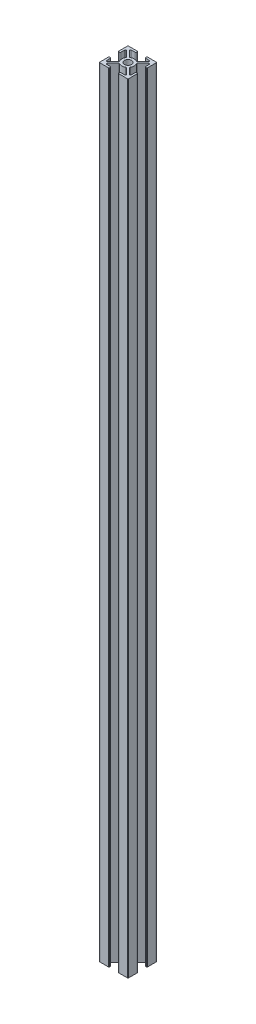
from build123d import *

# Parameters (mm, degrees)
SKETCH1_R           = 2.5
BOSS_EXTRUDE1_DEPTH = 540


with BuildPart() as part:
    # Sketch1 → Boss-Extrude1 (new body)
    with BuildSketch(Plane(origin=(0, 0, 0), x_dir=(1, 0, 0), z_dir=(0, 1, 0))):
        with BuildLine():
            Line((-6.247396549, 8.6), (-3.6, 8.6))
            ThreePointArc((-3.6, 8.6), (-3.317157288, 8.717157288), (-3.2, 9))
            Line((-3.2, 9), (-3.2, 9.6))
            ThreePointArc((-3.2, 9.6), (-3.317157288, 9.882842712), (-3.6, 10))
            Line((-3.6, 10), (-9.5, 10))
            ThreePointArc((-9.5, 10), (-9.853553391, 9.853553391), (-10, 9.5))
            Line((-10, 9.5), (-10, 3.6))
            ThreePointArc((-10, 3.6), (-9.882842712, 3.317157288), (-9.6, 3.2))
            Line((-9.6, 3.2), (-9, 3.2))
            ThreePointArc((-9, 3.2), (-8.717157288, 3.317157288), (-8.6, 3.6))
            Line((-8.6, 3.6), (-8.6, 6.402943725))
            ThreePointArc((-8.6, 6.402943725), (-8.291341716, 6.864883491), (-7.746446609, 6.756497116))
            Line((-7.746446609, 6.756497116), (-3.744782433, 2.75483294))
            ThreePointArc((-3.744782433, 2.75483294), (-3.602407081, 2.46495593), (-3.666932053, 2.148513281))
            ThreePointArc((-3.666932053, 2.148513281), (-4.25, 0), (-3.666932053, -2.148513281))
            ThreePointArc((-3.666932053, -2.148513281), (-3.602407081, -2.46495593), (-3.744782433, -2.75483294))
            Line((-3.744782433, -2.75483294), (-7.636458146, -6.646508652))
            ThreePointArc((-7.636458146, -6.646508652), (-8.251568164, -6.768861642), (-8.6, -6.247396549))
            Line((-8.6, -6.247396549), (-8.6, -3.6))
            ThreePointArc((-8.6, -3.6), (-8.717157288, -3.317157288), (-9, -3.2))
            Line((-9, -3.2), (-9.6, -3.2))
            ThreePointArc((-9.6, -3.2), (-9.882842712, -3.317157288), (-10, -3.6))
            Line((-10, -3.6), (-10, -9.5))
            ThreePointArc((-10, -9.5), (-9.853553391, -9.853553391), (-9.5, -10))
            Line((-9.5, -10), (-3.6, -10))
            ThreePointArc((-3.6, -10), (-3.317157288, -9.882842712), (-3.2, -9.6))
            Line((-3.2, -9.6), (-3.2, -9))
            ThreePointArc((-3.2, -9), (-3.317157288, -8.717157288), (-3.6, -8.6))
            Line((-3.6, -8.6), (-6.247396549, -8.6))
            ThreePointArc((-6.247396549, -8.6), (-6.768861642, -8.251568164), (-6.646508652, -7.636458146))
            Line((-6.646508652, -7.636458146), (-2.75483294, -3.744782433))
            ThreePointArc((-2.75483294, -3.744782433), (-2.46495593, -3.602407081), (-2.148513281, -3.666932053))
            ThreePointArc((-2.148513281, -3.666932053), (0, -4.25), (2.148513281, -3.666932053))
            ThreePointArc((2.148513281, -3.666932053), (2.46495593, -3.602407081), (2.75483294, -3.744782433))
            Line((2.75483294, -3.744782433), (6.646508652, -7.636458146))
            ThreePointArc((6.646508652, -7.636458146), (6.768861642, -8.251568164), (6.247396549, -8.6))
            Line((6.247396549, -8.6), (3.6, -8.6))
            ThreePointArc((3.6, -8.6), (3.317157288, -8.717157288), (3.2, -9))
            Line((3.2, -9), (3.2, -9.6))
            ThreePointArc((3.2, -9.6), (3.317157288, -9.882842712), (3.6, -10))
            Line((3.6, -10), (9.5, -10))
            ThreePointArc((9.5, -10), (9.853553391, -9.853553391), (10, -9.5))
            Line((10, -9.5), (10, -3.6))
            ThreePointArc((10, -3.6), (9.882842712, -3.317157288), (9.6, -3.2))
            Line((9.6, -3.2), (9, -3.2))
            ThreePointArc((9, -3.2), (8.717157288, -3.317157288), (8.6, -3.6))
            Line((8.6, -3.6), (8.6, -6.247396549))
            ThreePointArc((8.6, -6.247396549), (8.251568164, -6.768861642), (7.636458146, -6.646508652))
            Line((7.636458146, -6.646508652), (3.744782433, -2.75483294))
            ThreePointArc((3.744782433, -2.75483294), (3.602407081, -2.46495593), (3.666932053, -2.148513281))
            ThreePointArc((3.666932053, -2.148513281), (4.25, 0), (3.666932053, 2.148513281))
            ThreePointArc((3.666932053, 2.148513281), (3.602407081, 2.46495593), (3.744782433, 2.75483294))
            Line((3.744782433, 2.75483294), (7.636458146, 6.646508652))
            ThreePointArc((7.636458146, 6.646508652), (8.251568164, 6.768861642), (8.6, 6.247396549))
            Line((8.6, 6.247396549), (8.6, 3.6))
            ThreePointArc((8.6, 3.6), (8.717157288, 3.317157288), (9, 3.2))
            Line((9, 3.2), (9.6, 3.2))
            ThreePointArc((9.6, 3.2), (9.882842712, 3.317157288), (10, 3.6))
            Line((10, 3.6), (10, 9.5))
            ThreePointArc((10, 9.5), (9.853553391, 9.853553391), (9.5, 10))
            Line((9.5, 10), (3.6, 10))
            ThreePointArc((3.6, 10), (3.317157288, 9.882842712), (3.2, 9.6))
            Line((3.2, 9.6), (3.2, 9))
            ThreePointArc((3.2, 9), (3.317157288, 8.717157288), (3.6, 8.6))
            Line((3.6, 8.6), (6.247396549, 8.6))
            ThreePointArc((6.247396549, 8.6), (6.768861642, 8.251568164), (6.646508652, 7.636458146))
            Line((6.646508652, 7.636458146), (2.75483294, 3.744782433))
            ThreePointArc((2.75483294, 3.744782433), (2.46495593, 3.602407081), (2.148513281, 3.666932053))
            ThreePointArc((2.148513281, 3.666932053), (0, 4.25), (-2.148513281, 3.666932053))
            ThreePointArc((-2.148513281, 3.666932053), (-2.46495593, 3.602407081), (-2.75483294, 3.744782433))
            Line((-2.75483294, 3.744782433), (-6.646508652, 7.636458146))
            ThreePointArc((-6.646508652, 7.636458146), (-6.768861642, 8.251568164), (-6.247396549, 8.6))
        make_face()
        Circle(SKETCH1_R, mode=Mode.SUBTRACT)
    extrude(amount=BOSS_EXTRUDE1_DEPTH)


solid = part.part
